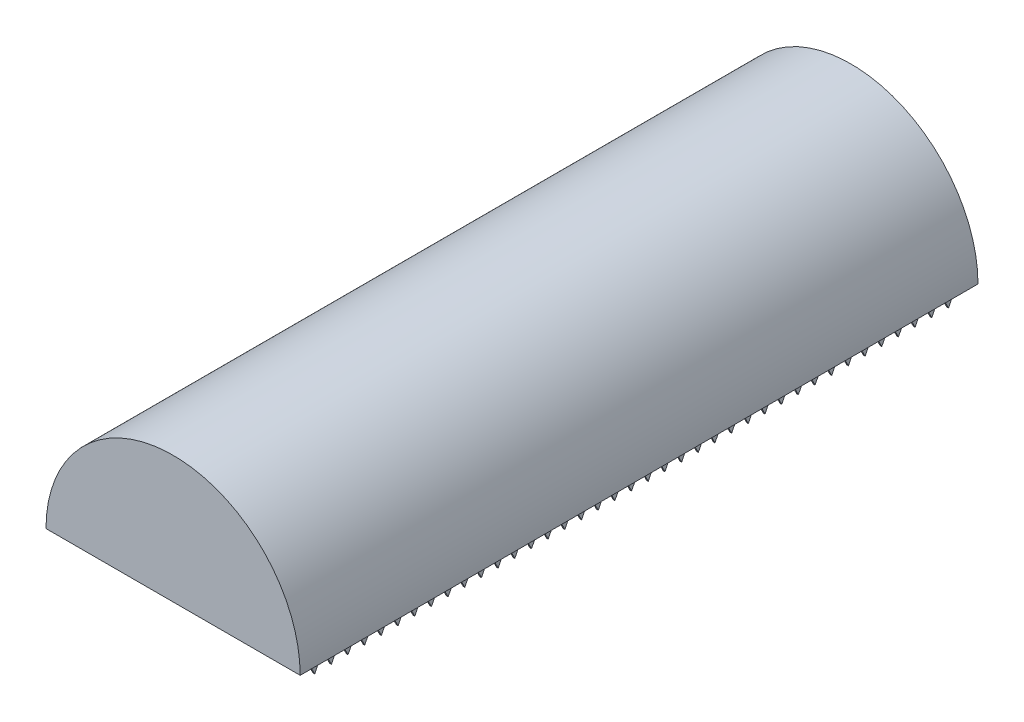
from build123d import *

# Parameters (mm, degrees)
BOSS_EXTRUDE1_DEPTH    = 406.4
SHELL1_T               = -6.35
BOSS_EXTRUDE2_DEPTH    = 1
BOSS_EXTRUDE2_2_DEPTH  = 1
BOSS_EXTRUDE2_3_DEPTH  = 1
BOSS_EXTRUDE2_4_DEPTH  = 1
BOSS_EXTRUDE2_5_DEPTH  = 1
BOSS_EXTRUDE2_6_DEPTH  = 1
BOSS_EXTRUDE2_7_DEPTH  = 1
BOSS_EXTRUDE2_8_DEPTH  = 1
BOSS_EXTRUDE2_9_DEPTH  = 1
BOSS_EXTRUDE2_10_DEPTH = 1
BOSS_EXTRUDE2_11_DEPTH = 1
BOSS_EXTRUDE2_12_DEPTH = 1
BOSS_EXTRUDE2_13_DEPTH = 1
BOSS_EXTRUDE2_14_DEPTH = 1
BOSS_EXTRUDE2_15_DEPTH = 1
BOSS_EXTRUDE2_16_DEPTH = 1
BOSS_EXTRUDE2_17_DEPTH = 1
BOSS_EXTRUDE2_18_DEPTH = 1
BOSS_EXTRUDE2_19_DEPTH = 1
BOSS_EXTRUDE2_20_DEPTH = 1
BOSS_EXTRUDE2_21_DEPTH = 1
BOSS_EXTRUDE2_22_DEPTH = 1
BOSS_EXTRUDE2_23_DEPTH = 1
BOSS_EXTRUDE2_24_DEPTH = 1
BOSS_EXTRUDE2_25_DEPTH = 1
BOSS_EXTRUDE2_26_DEPTH = 1
BOSS_EXTRUDE2_27_DEPTH = 1
BOSS_EXTRUDE2_28_DEPTH = 1
BOSS_EXTRUDE2_29_DEPTH = 1
BOSS_EXTRUDE2_30_DEPTH = 1
BOSS_EXTRUDE2_31_DEPTH = 1
BOSS_EXTRUDE2_32_DEPTH = 1
BOSS_EXTRUDE2_33_DEPTH = 1
BOSS_EXTRUDE2_34_DEPTH = 1
BOSS_EXTRUDE2_35_DEPTH = 1
BOSS_EXTRUDE2_36_DEPTH = 1
BOSS_EXTRUDE2_37_DEPTH = 1
BOSS_EXTRUDE2_38_DEPTH = 1
BOSS_EXTRUDE2_39_DEPTH = 1


with BuildPart() as part:
    # Sketch1 → Boss-Extrude1 (new body)
    with BuildSketch(Plane.XY):
        with BuildLine():
            Line((-76.2, 0), (76.2, 0))
            ThreePointArc((76.2, 0), (0, 76.2), (-76.2, 0))
        make_face()
    extrude(amount=BOSS_EXTRUDE1_DEPTH)

    # Shell1
    shell1_openings = [part.faces().sort_by_distance(p)[0] for p in [
        (0, 0, 203.2),
    ]]
    offset(amount=SHELL1_T, openings=shell1_openings)


with BuildPart() as body_2:
    # Sketch3 → Boss-Extrude2 (new body)
    with BuildSketch(Plane(origin=(69.85, 0, 0), x_dir=(0, 0, -1), z_dir=(1, 0, 0))):
        Polygon((-391.35, -10), (-386.35, 0), (-396.35, 0), align=None)
    extrude(amount=-BOSS_EXTRUDE2_DEPTH)


with BuildPart() as body_3:
    # Sketch3 → Boss-Extrude2 2 (new body)
    with BuildSketch(Plane(origin=(69.85, 0, 0), x_dir=(0, 0, -1), z_dir=(1, 0, 0))):
        Polygon((-381.35, -10), (-376.35, 0), (-386.35, 0), align=None)
    extrude(amount=-BOSS_EXTRUDE2_2_DEPTH)


with BuildPart() as body_4:
    # Sketch3 → Boss-Extrude2 3 (new body)
    with BuildSketch(Plane(origin=(69.85, 0, 0), x_dir=(0, 0, -1), z_dir=(1, 0, 0))):
        Polygon((-371.35, -10), (-366.35, 0), (-376.35, 0), align=None)
    extrude(amount=-BOSS_EXTRUDE2_3_DEPTH)


with BuildPart() as body_5:
    # Sketch3 → Boss-Extrude2 4 (new body)
    with BuildSketch(Plane(origin=(69.85, 0, 0), x_dir=(0, 0, -1), z_dir=(1, 0, 0))):
        Polygon((-361.35, -10), (-356.35, 0), (-366.35, 0), align=None)
    extrude(amount=-BOSS_EXTRUDE2_4_DEPTH)


with BuildPart() as body_6:
    # Sketch3 → Boss-Extrude2 5 (new body)
    with BuildSketch(Plane(origin=(69.85, 0, 0), x_dir=(0, 0, -1), z_dir=(1, 0, 0))):
        Polygon((-351.35, -10), (-346.35, 0), (-356.35, 0), align=None)
    extrude(amount=-BOSS_EXTRUDE2_5_DEPTH)


with BuildPart() as body_7:
    # Sketch3 → Boss-Extrude2 6 (new body)
    with BuildSketch(Plane(origin=(69.85, 0, 0), x_dir=(0, 0, -1), z_dir=(1, 0, 0))):
        Polygon((-341.35, -10), (-336.35, 0), (-346.35, 0), align=None)
    extrude(amount=-BOSS_EXTRUDE2_6_DEPTH)


with BuildPart() as body_8:
    # Sketch3 → Boss-Extrude2 7 (new body)
    with BuildSketch(Plane(origin=(69.85, 0, 0), x_dir=(0, 0, -1), z_dir=(1, 0, 0))):
        Polygon((-331.35, -10), (-326.35, 0), (-336.35, 0), align=None)
    extrude(amount=-BOSS_EXTRUDE2_7_DEPTH)


with BuildPart() as body_9:
    # Sketch3 → Boss-Extrude2 8 (new body)
    with BuildSketch(Plane(origin=(69.85, 0, 0), x_dir=(0, 0, -1), z_dir=(1, 0, 0))):
        Polygon((-321.35, -10), (-316.35, 0), (-326.35, 0), align=None)
    extrude(amount=-BOSS_EXTRUDE2_8_DEPTH)


with BuildPart() as body_10:
    # Sketch3 → Boss-Extrude2 9 (new body)
    with BuildSketch(Plane(origin=(69.85, 0, 0), x_dir=(0, 0, -1), z_dir=(1, 0, 0))):
        Polygon((-311.35, -10), (-306.35, 0), (-316.35, 0), align=None)
    extrude(amount=-BOSS_EXTRUDE2_9_DEPTH)


with BuildPart() as body_11:
    # Sketch3 → Boss-Extrude2 10 (new body)
    with BuildSketch(Plane(origin=(69.85, 0, 0), x_dir=(0, 0, -1), z_dir=(1, 0, 0))):
        Polygon((-301.35, -10), (-296.35, 0), (-306.35, 0), align=None)
    extrude(amount=-BOSS_EXTRUDE2_10_DEPTH)


with BuildPart() as body_12:
    # Sketch3 → Boss-Extrude2 11 (new body)
    with BuildSketch(Plane(origin=(69.85, 0, 0), x_dir=(0, 0, -1), z_dir=(1, 0, 0))):
        Polygon((-291.35, -10), (-286.35, 0), (-296.35, 0), align=None)
    extrude(amount=-BOSS_EXTRUDE2_11_DEPTH)


with BuildPart() as body_13:
    # Sketch3 → Boss-Extrude2 12 (new body)
    with BuildSketch(Plane(origin=(69.85, 0, 0), x_dir=(0, 0, -1), z_dir=(1, 0, 0))):
        Polygon((-281.35, -10), (-276.35, 0), (-286.35, 0), align=None)
    extrude(amount=-BOSS_EXTRUDE2_12_DEPTH)


with BuildPart() as body_14:
    # Sketch3 → Boss-Extrude2 13 (new body)
    with BuildSketch(Plane(origin=(69.85, 0, 0), x_dir=(0, 0, -1), z_dir=(1, 0, 0))):
        Polygon((-271.35, -10), (-266.35, 0), (-276.35, 0), align=None)
    extrude(amount=-BOSS_EXTRUDE2_13_DEPTH)


with BuildPart() as body_15:
    # Sketch3 → Boss-Extrude2 14 (new body)
    with BuildSketch(Plane(origin=(69.85, 0, 0), x_dir=(0, 0, -1), z_dir=(1, 0, 0))):
        Polygon((-261.35, -10), (-256.35, 0), (-266.35, 0), align=None)
    extrude(amount=-BOSS_EXTRUDE2_14_DEPTH)


with BuildPart() as body_16:
    # Sketch3 → Boss-Extrude2 15 (new body)
    with BuildSketch(Plane(origin=(69.85, 0, 0), x_dir=(0, 0, -1), z_dir=(1, 0, 0))):
        Polygon((-251.35, -10), (-246.35, 0), (-256.35, 0), align=None)
    extrude(amount=-BOSS_EXTRUDE2_15_DEPTH)


with BuildPart() as body_17:
    # Sketch3 → Boss-Extrude2 16 (new body)
    with BuildSketch(Plane(origin=(69.85, 0, 0), x_dir=(0, 0, -1), z_dir=(1, 0, 0))):
        Polygon((-241.35, -10), (-236.35, 0), (-246.35, 0), align=None)
    extrude(amount=-BOSS_EXTRUDE2_16_DEPTH)


with BuildPart() as body_18:
    # Sketch3 → Boss-Extrude2 17 (new body)
    with BuildSketch(Plane(origin=(69.85, 0, 0), x_dir=(0, 0, -1), z_dir=(1, 0, 0))):
        Polygon((-231.35, -10), (-226.35, 0), (-236.35, 0), align=None)
    extrude(amount=-BOSS_EXTRUDE2_17_DEPTH)


with BuildPart() as body_19:
    # Sketch3 → Boss-Extrude2 18 (new body)
    with BuildSketch(Plane(origin=(69.85, 0, 0), x_dir=(0, 0, -1), z_dir=(1, 0, 0))):
        Polygon((-221.35, -10), (-216.35, 0), (-226.35, 0), align=None)
    extrude(amount=-BOSS_EXTRUDE2_18_DEPTH)


with BuildPart() as body_20:
    # Sketch3 → Boss-Extrude2 19 (new body)
    with BuildSketch(Plane(origin=(69.85, 0, 0), x_dir=(0, 0, -1), z_dir=(1, 0, 0))):
        Polygon((-211.35, -10), (-206.35, 0), (-216.35, 0), align=None)
    extrude(amount=-BOSS_EXTRUDE2_19_DEPTH)


with BuildPart() as body_21:
    # Sketch3 → Boss-Extrude2 20 (new body)
    with BuildSketch(Plane(origin=(69.85, 0, 0), x_dir=(0, 0, -1), z_dir=(1, 0, 0))):
        Polygon((-201.35, -10), (-196.35, 0), (-206.35, 0), align=None)
    extrude(amount=-BOSS_EXTRUDE2_20_DEPTH)


with BuildPart() as body_22:
    # Sketch3 → Boss-Extrude2 21 (new body)
    with BuildSketch(Plane(origin=(69.85, 0, 0), x_dir=(0, 0, -1), z_dir=(1, 0, 0))):
        Polygon((-191.35, -10), (-186.35, 0), (-196.35, 0), align=None)
    extrude(amount=-BOSS_EXTRUDE2_21_DEPTH)


with BuildPart() as body_23:
    # Sketch3 → Boss-Extrude2 22 (new body)
    with BuildSketch(Plane(origin=(69.85, 0, 0), x_dir=(0, 0, -1), z_dir=(1, 0, 0))):
        Polygon((-181.35, -10), (-176.35, 0), (-186.35, 0), align=None)
    extrude(amount=-BOSS_EXTRUDE2_22_DEPTH)


with BuildPart() as body_24:
    # Sketch3 → Boss-Extrude2 23 (new body)
    with BuildSketch(Plane(origin=(69.85, 0, 0), x_dir=(0, 0, -1), z_dir=(1, 0, 0))):
        Polygon((-171.35, -10), (-166.35, 0), (-176.35, 0), align=None)
    extrude(amount=-BOSS_EXTRUDE2_23_DEPTH)


with BuildPart() as body_25:
    # Sketch3 → Boss-Extrude2 24 (new body)
    with BuildSketch(Plane(origin=(69.85, 0, 0), x_dir=(0, 0, -1), z_dir=(1, 0, 0))):
        Polygon((-161.35, -10), (-156.35, 0), (-166.35, 0), align=None)
    extrude(amount=-BOSS_EXTRUDE2_24_DEPTH)


with BuildPart() as body_26:
    # Sketch3 → Boss-Extrude2 25 (new body)
    with BuildSketch(Plane(origin=(69.85, 0, 0), x_dir=(0, 0, -1), z_dir=(1, 0, 0))):
        Polygon((-151.35, -10), (-146.35, 0), (-156.35, 0), align=None)
    extrude(amount=-BOSS_EXTRUDE2_25_DEPTH)


with BuildPart() as body_27:
    # Sketch3 → Boss-Extrude2 26 (new body)
    with BuildSketch(Plane(origin=(69.85, 0, 0), x_dir=(0, 0, -1), z_dir=(1, 0, 0))):
        Polygon((-141.35, -10), (-136.35, 0), (-146.35, 0), align=None)
    extrude(amount=-BOSS_EXTRUDE2_26_DEPTH)


with BuildPart() as body_28:
    # Sketch3 → Boss-Extrude2 27 (new body)
    with BuildSketch(Plane(origin=(69.85, 0, 0), x_dir=(0, 0, -1), z_dir=(1, 0, 0))):
        Polygon((-131.35, -10), (-126.35, 0), (-136.35, 0), align=None)
    extrude(amount=-BOSS_EXTRUDE2_27_DEPTH)


with BuildPart() as body_29:
    # Sketch3 → Boss-Extrude2 28 (new body)
    with BuildSketch(Plane(origin=(69.85, 0, 0), x_dir=(0, 0, -1), z_dir=(1, 0, 0))):
        Polygon((-121.35, -10), (-116.35, 0), (-126.35, 0), align=None)
    extrude(amount=-BOSS_EXTRUDE2_28_DEPTH)


with BuildPart() as body_30:
    # Sketch3 → Boss-Extrude2 29 (new body)
    with BuildSketch(Plane(origin=(69.85, 0, 0), x_dir=(0, 0, -1), z_dir=(1, 0, 0))):
        Polygon((-111.35, -10), (-106.35, 0), (-116.35, 0), align=None)
    extrude(amount=-BOSS_EXTRUDE2_29_DEPTH)


with BuildPart() as body_31:
    # Sketch3 → Boss-Extrude2 30 (new body)
    with BuildSketch(Plane(origin=(69.85, 0, 0), x_dir=(0, 0, -1), z_dir=(1, 0, 0))):
        Polygon((-101.35, -10), (-96.35, 0), (-106.35, 0), align=None)
    extrude(amount=-BOSS_EXTRUDE2_30_DEPTH)


with BuildPart() as body_32:
    # Sketch3 → Boss-Extrude2 31 (new body)
    with BuildSketch(Plane(origin=(69.85, 0, 0), x_dir=(0, 0, -1), z_dir=(1, 0, 0))):
        Polygon((-91.35, -10), (-86.35, 0), (-96.35, 0), align=None)
    extrude(amount=-BOSS_EXTRUDE2_31_DEPTH)


with BuildPart() as body_33:
    # Sketch3 → Boss-Extrude2 32 (new body)
    with BuildSketch(Plane(origin=(69.85, 0, 0), x_dir=(0, 0, -1), z_dir=(1, 0, 0))):
        Polygon((-81.35, -10), (-76.35, 0), (-86.35, 0), align=None)
    extrude(amount=-BOSS_EXTRUDE2_32_DEPTH)


with BuildPart() as body_34:
    # Sketch3 → Boss-Extrude2 33 (new body)
    with BuildSketch(Plane(origin=(69.85, 0, 0), x_dir=(0, 0, -1), z_dir=(1, 0, 0))):
        Polygon((-71.35, -10), (-66.35, 0), (-76.35, 0), align=None)
    extrude(amount=-BOSS_EXTRUDE2_33_DEPTH)


with BuildPart() as body_35:
    # Sketch3 → Boss-Extrude2 34 (new body)
    with BuildSketch(Plane(origin=(69.85, 0, 0), x_dir=(0, 0, -1), z_dir=(1, 0, 0))):
        Polygon((-61.35, -10), (-56.35, 0), (-66.35, 0), align=None)
    extrude(amount=-BOSS_EXTRUDE2_34_DEPTH)


with BuildPart() as body_36:
    # Sketch3 → Boss-Extrude2 35 (new body)
    with BuildSketch(Plane(origin=(69.85, 0, 0), x_dir=(0, 0, -1), z_dir=(1, 0, 0))):
        Polygon((-51.35, -10), (-46.35, 0), (-56.35, 0), align=None)
    extrude(amount=-BOSS_EXTRUDE2_35_DEPTH)


with BuildPart() as body_37:
    # Sketch3 → Boss-Extrude2 36 (new body)
    with BuildSketch(Plane(origin=(69.85, 0, 0), x_dir=(0, 0, -1), z_dir=(1, 0, 0))):
        Polygon((-41.35, -10), (-36.35, 0), (-46.35, 0), align=None)
    extrude(amount=-BOSS_EXTRUDE2_36_DEPTH)


with BuildPart() as body_38:
    # Sketch3 → Boss-Extrude2 37 (new body)
    with BuildSketch(Plane(origin=(69.85, 0, 0), x_dir=(0, 0, -1), z_dir=(1, 0, 0))):
        Polygon((-31.35, -10), (-26.35, 0), (-36.35, 0), align=None)
    extrude(amount=-BOSS_EXTRUDE2_37_DEPTH)


with BuildPart() as body_39:
    # Sketch3 → Boss-Extrude2 38 (new body)
    with BuildSketch(Plane(origin=(69.85, 0, 0), x_dir=(0, 0, -1), z_dir=(1, 0, 0))):
        Polygon((-21.35, -10), (-16.35, 0), (-26.35, 0), align=None)
    extrude(amount=-BOSS_EXTRUDE2_38_DEPTH)


with BuildPart() as body_40:
    # Sketch3 → Boss-Extrude2 39 (new body)
    with BuildSketch(Plane(origin=(69.85, 0, 0), x_dir=(0, 0, -1), z_dir=(1, 0, 0))):
        Polygon((-11.35, -10), (-6.35, 0), (-16.35, 0), align=None)
    extrude(amount=-BOSS_EXTRUDE2_39_DEPTH)


solid = Compound([part.part, body_2.part, body_3.part, body_4.part, body_5.part, body_6.part, body_7.part, body_8.part, body_9.part, body_10.part, body_11.part, body_12.part, body_13.part, body_14.part, body_15.part, body_16.part, body_17.part, body_18.part, body_19.part, body_20.part, body_21.part, body_22.part, body_23.part, body_24.part, body_25.part, body_26.part, body_27.part, body_28.part, body_29.part, body_30.part, body_31.part, body_32.part, body_33.part, body_34.part, body_35.part, body_36.part, body_37.part, body_38.part, body_39.part, body_40.part])
